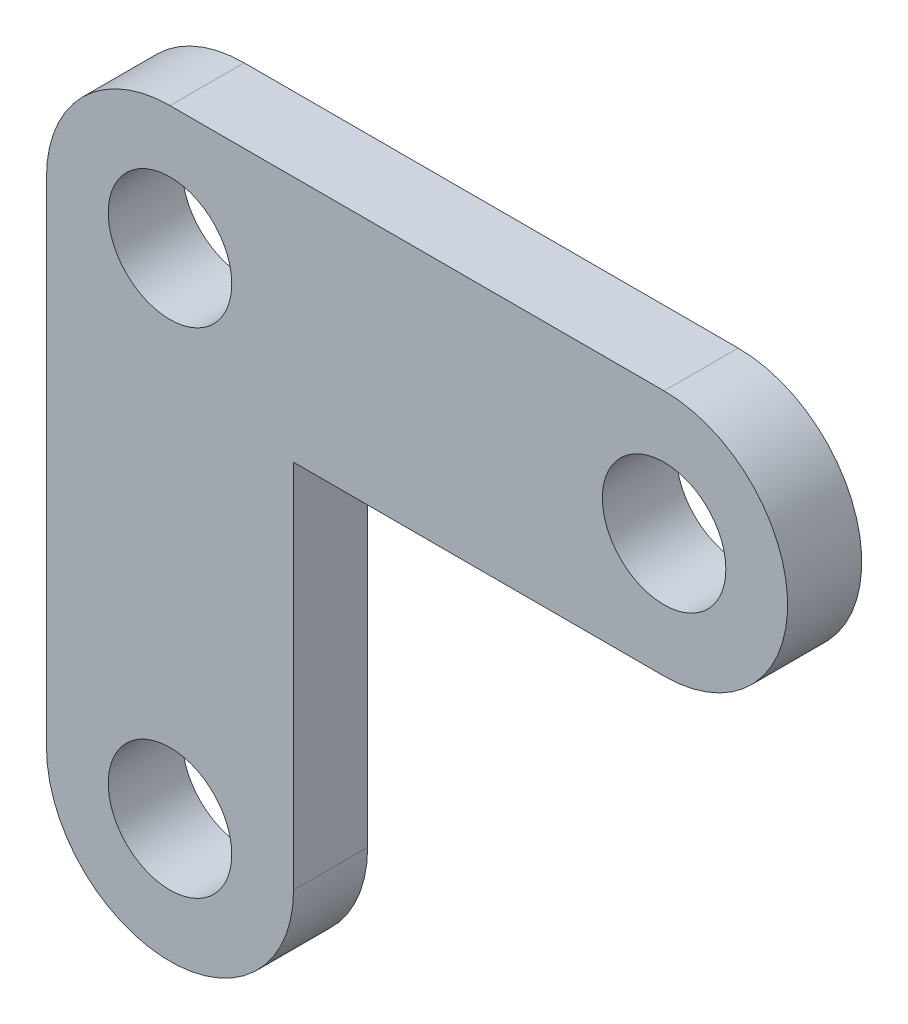
from build123d import *

# Parameters (mm, degrees)
SKETCH1_R           = 2.5
BOSS_EXTRUDE1_DEPTH = 3


with BuildPart() as part:
    # Sketch1 → Boss-Extrude1 (new body)
    with BuildSketch(Plane.XY):
        with BuildLine():
            Line((4.001181793, 31.666122725), (4.001181793, 11.666122725))
            ThreePointArc((4.001181793, 11.666122725), (9.001181793, 6.666122725), (14.001181793, 11.666122725))
            Line((14.001181793, 11.666122725), (14.001181793, 26.666122725))
            Line((14.001181793, 26.666122725), (29.001181793, 26.666122725))
            ThreePointArc((29.001181793, 26.666122725), (34.001181793, 31.666122725), (29.001181793, 36.666122725))
            Line((29.001181793, 36.666122725), (9.001181793, 36.666122725))
            ThreePointArc((9.001181793, 36.666122725), (5.465647887, 35.201656631), (4.001181793, 31.666122725))
        make_face()
        with Locations((9.001181793, 31.666122725)):
            Circle(SKETCH1_R, mode=Mode.SUBTRACT)
        with Locations((9.001181793, 11.666122725)):
            Circle(SKETCH1_R, mode=Mode.SUBTRACT)
        with Locations((29.001181793, 31.666122725)):
            Circle(SKETCH1_R, mode=Mode.SUBTRACT)
    extrude(amount=BOSS_EXTRUDE1_DEPTH)


solid = part.part
